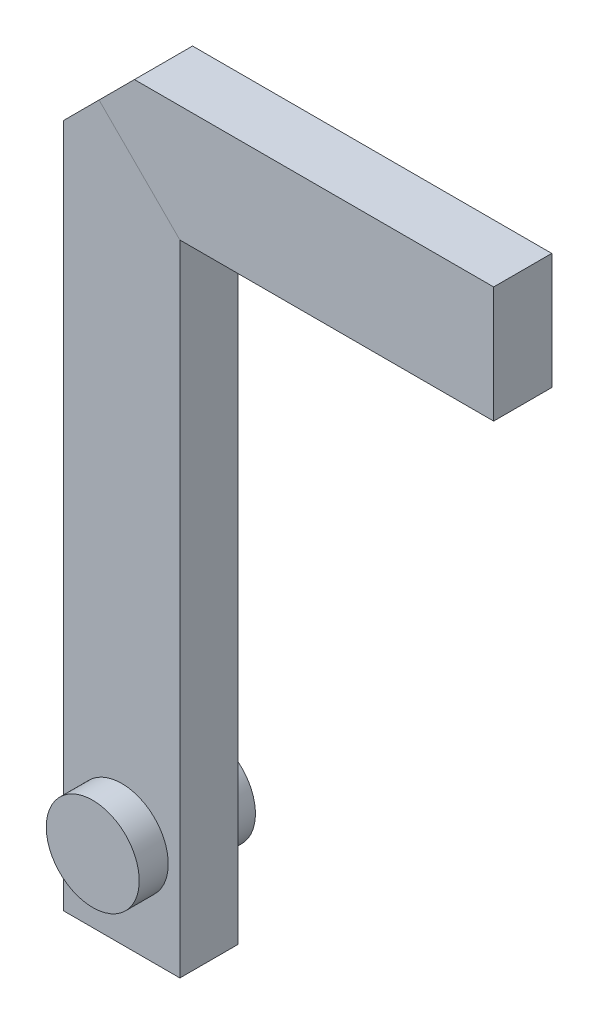
from build123d import *

# Parameters (mm, degrees)
CUT_EXTRUDE1_DEPTH       = 47.115167245
BOSS_EXTRUDE1_DEPTH      = 4.7625
BOSS_EXTRUDE1_DEPTH_BACK = 1.5875
BOSS_EXTRUDE1_START      = -3.175


with BuildPart() as part:
    # Sweep1: sweep along a path in Sketch1
    with BuildLine(Plane.XY) as sweep1_path:
        Line((0, 0), (0, 38.1))
        Line((0, 38.1), (20.32, 38.1))
    # 3DSketch2 → Sweep1 (sweep)
    with BuildSketch(Plane(origin=(20.32, 34.925, -1.5875), x_dir=(0, 0.894427190999916, 0.4472135954999578), z_dir=(-1, 0, 0))):
        Polygon((0, 0), (5.679612663, 2.839806331), (7.099515829, 0), (1.419903166, -2.839806331), align=None)
    sweep(path=sweep1_path.line, transition=Transition.RIGHT)

    # Sketch2 → Cut-Extrude1 (cut, through all)
    with BuildSketch(Plane.XY.offset(1.5875)):
        Polygon((-3.175, 37.409050104), (0.690949896, 41.275), (-3.175, 41.275), align=None)
    extrude(amount=-CUT_EXTRUDE1_DEPTH, mode=Mode.SUBTRACT)

    # Sketch3 → Boss-Extrude1 (add, two sides: drawn at the far end of the back side and taken through both)
    with BuildSketch(Plane.XY.offset(1.5875).offset(BOSS_EXTRUDE1_START - BOSS_EXTRUDE1_DEPTH_BACK)):
        with BuildLine():
            ThreePointArc((0, 2.54), (1.796051224, 3.283948776), (2.54, 5.08))
            ThreePointArc((2.54, 5.08), (-1.796051224, 6.876051224), (0, 2.54))
        make_face()
    extrude(amount=BOSS_EXTRUDE1_DEPTH + BOSS_EXTRUDE1_DEPTH_BACK)


solid = part.part
